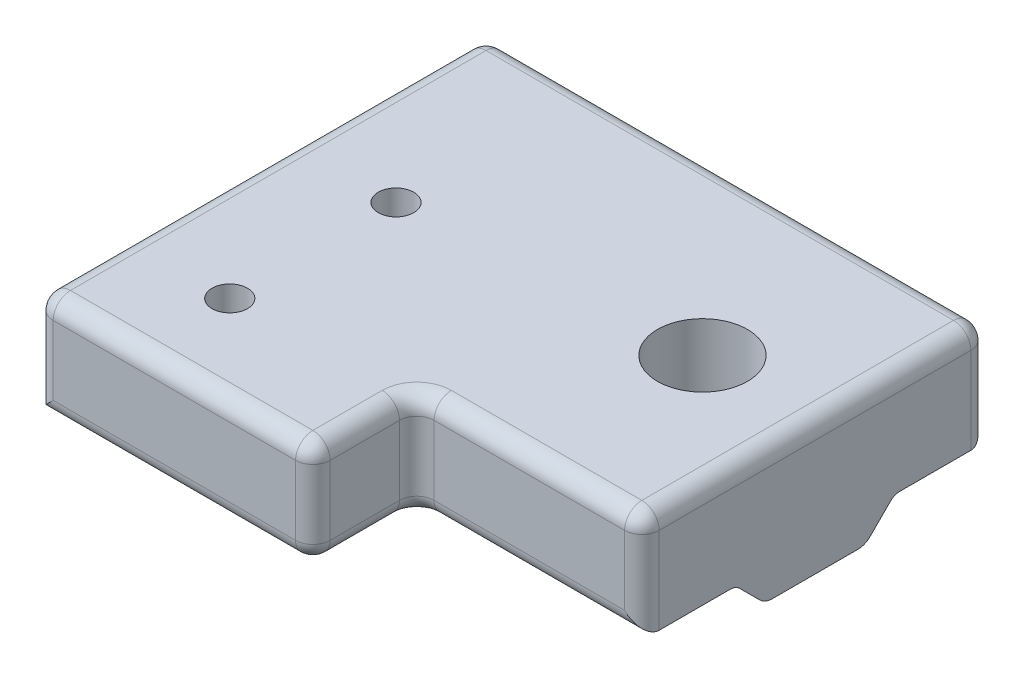
from build123d import *

# Parameters (mm, degrees)
SKETCH1_W           = 20
SKETCH1_H           = 6
BOSS_EXTRUDE1_DEPTH = 13
CUT_EXTRUDE1_REACH  = 51.362
SKETCH2_R           = 2.6
BOSS_EXTRUDE3_START = 16
BOSS_EXTRUDE3_DEPTH = 16
SKETCH6_W           = 16
SKETCH6_H           = 6
BOSS_EXTRUDE4_DEPTH = 6
SKETCH7_R           = 1.025
CUT_EXTRUDE3_DEPTH  = 6
FILLET3_R           = 1


with BuildPart() as part:
    # Sketch1 → Boss-Extrude1 (new body)
    with BuildSketch(Plane(origin=(32.364284334, 0, 0), x_dir=(0, 0, -1), z_dir=(1, 0, 0))):
        with Locations((-7.875866483, 38.765059464)):
            Rectangle(SKETCH1_W, SKETCH1_H)
        with BuildLine():
            Line((-12.22448084, 35.533673821), (-10.765866483, 34.075059464))
            Line((-10.765866483, 34.075059464), (-4.985866483, 34.075059464))
            Line((-4.985866483, 34.075059464), (-3.527252126, 35.533673821))
            ThreePointArc((-3.527252126, 35.533673821), (-3.27095768, 35.704924294), (-2.968637768, 35.765059464))
            Line((-2.968637768, 35.765059464), (-12.783095197, 35.765059464))
            ThreePointArc((-12.783095197, 35.765059464), (-12.480775285, 35.704924294), (-12.22448084, 35.533673821))
        make_face()
    extrude(amount=BOSS_EXTRUDE1_DEPTH)

    # Sketch2 → Cut-Extrude1 (cut, up to next)
    with BuildSketch(Plane.XZ.offset(-34.075059464), mode=Mode.PRIVATE) as cut_extrude1_sk1:
        with Locations(Location((38.864284334, 7.875866483, 0), (0, 0, 270))):
            Circle(SKETCH2_R)
    cut_extrude1_tool1 = extrude(cut_extrude1_sk1.sketch, amount=-CUT_EXTRUDE1_REACH, mode=Mode.PRIVATE) & part.part
    add(cut_extrude1_tool1.solids().sort_by_distance((38.864284, 34.075059, 7.875866))[0], mode=Mode.SUBTRACT)

    # Sketch5 → Boss-Extrude3 (add)
    with BuildSketch(Plane.ZY.offset(-32.364284334).offset(BOSS_EXTRUDE3_START)):
        with BuildLine():
            Line((12.783095197, 35.765059464), (17.875866483, 35.765059464))
            Line((17.875866483, 35.765059464), (17.875866483, 41.765059464))
            Line((17.875866483, 41.765059464), (-2.124133517, 41.765059464))
            Line((-2.124133517, 41.765059464), (-2.124133517, 35.765059464))
            Line((-2.124133517, 35.765059464), (2.968637768, 35.765059464))
            ThreePointArc((2.968637768, 35.765059464), (3.27095768, 35.704924294), (3.527252126, 35.533673821))
            Line((3.527252126, 35.533673821), (4.985866483, 34.075059464))
            Line((4.985866483, 34.075059464), (10.765866483, 34.075059464))
            Line((10.765866483, 34.075059464), (12.22448084, 35.533673821))
            ThreePointArc((12.22448084, 35.533673821), (12.480775285, 35.704924294), (12.783095197, 35.765059464))
        make_face()
    extrude(amount=-BOSS_EXTRUDE3_DEPTH)

    # Sketch6 → Boss-Extrude4 (add)
    with BuildSketch(Plane.XY.offset(17.875866483)):
        with Locations((24.364284334, 38.765059464)):
            Rectangle(SKETCH6_W, SKETCH6_H)
    extrude(amount=BOSS_EXTRUDE4_DEPTH)

    # Sketch7 → Cut-Extrude3 (cut)
    with BuildSketch(Plane(origin=(0, 41.765059464, 0), x_dir=(1, 0, 0), z_dir=(0, 1, 0))):
        with Locations(Location((22.364284334, -9.075866483, 0), (0, 0, 270))):
            Circle(SKETCH7_R)
        with Locations(Location((22.364284334, -18.675866483, 0), (0, 0, 270))):
            Circle(SKETCH7_R)
    extrude(amount=-CUT_EXTRUDE3_DEPTH, mode=Mode.SUBTRACT)

    # Fillet3
    # the kernel refuses this fillet: 1 mm, written as the material it adds along each edge
    with BuildSketch(Plane(origin=(32.364284334, 41.765059464, 17.875866483), x_dir=(1, 0, 0), z_dir=(0, -1, 0))) as fillet3_piece_1:
        with BuildLine():
            CenterArc((FILLET3_R, FILLET3_R), FILLET3_R, 180, 90)
            Line((0, FILLET3_R), (0, 0))
            Line((0, 0), (FILLET3_R, 0))
        make_face()
    extrude(amount=6)
    # the kernel refuses this fillet: 1 mm, written as the material it takes off along each edge
    with BuildSketch(Plane(origin=(17.364284334, 40.765059464, 22.875866483), x_dir=(-1, 0, 0), z_dir=(0, 1, 0))) as fillet3_2_piece_1_section:
        Polygon((0, 0), (FILLET3_R, 0), (FILLET3_R, FILLET3_R), (0, FILLET3_R), align=None)
    fillet3_2_piece_1 = extrude(amount=FILLET3_R, mode=Mode.PRIVATE)
    fillet3_2_piece_1 = fillet3_2_piece_1 - Plane(origin=(17.364284334, 40.765059464, 22.875866483), x_dir=(0.7071067811865475, 0, -0.7071067811865475), z_dir=(0, 1, 0)) * Sphere(FILLET3_R, mode=Mode.PRIVATE)
    add(fillet3_2_piece_1, mode=Mode.SUBTRACT)
    with BuildSketch(Plane(origin=(17.364284334, 40.765059464, -1.124133517), x_dir=(-1, 0, 0), z_dir=(0, 1, 0))) as fillet3_2_piece_2_section:
        Polygon((0, 0), (FILLET3_R, 0), (FILLET3_R, -FILLET3_R), (0, -FILLET3_R), align=None)
    fillet3_2_piece_2 = extrude(amount=FILLET3_R, mode=Mode.PRIVATE)
    fillet3_2_piece_2 = fillet3_2_piece_2 - Plane(origin=(17.364284334, 40.765059464, -1.124133517), x_dir=(0.7071067811865475, 0, 0.7071067811865475), z_dir=(0, 1, 0)) * Sphere(FILLET3_R, mode=Mode.PRIVATE)
    add(fillet3_2_piece_2, mode=Mode.SUBTRACT)
    with BuildSketch(Plane(origin=(31.364284334, 36.765059464, 22.875866483), x_dir=(0, 0, 1), z_dir=(0, -1, 0))) as fillet3_2_piece_3_section:
        Polygon((0, 0), (FILLET3_R, 0), (FILLET3_R, -FILLET3_R), (0, -FILLET3_R), align=None)
    fillet3_2_piece_3 = extrude(amount=FILLET3_R, mode=Mode.PRIVATE)
    fillet3_2_piece_3 = fillet3_2_piece_3 - Plane(origin=(31.364284334, 36.765059464, 22.875866483), x_dir=(-0.7071067811865475, 0, -0.7071067811865475), z_dir=(0, -1, 0)) * Sphere(FILLET3_R, mode=Mode.PRIVATE)
    add(fillet3_2_piece_3, mode=Mode.SUBTRACT)
    with BuildSketch(Plane(origin=(31.364284334, 40.765059464, 22.875866483), x_dir=(0, 0, 1), z_dir=(0, 1, 0))) as fillet3_2_piece_4_section:
        Polygon((0, 0), (FILLET3_R, 0), (FILLET3_R, FILLET3_R), (0, FILLET3_R), align=None)
    fillet3_2_piece_4 = extrude(amount=FILLET3_R, mode=Mode.PRIVATE)
    fillet3_2_piece_4 = fillet3_2_piece_4 - Plane(origin=(31.364284334, 40.765059464, 22.875866483), x_dir=(-0.7071067811865475, 0, -0.7071067811865475), z_dir=(0, 1, 0)) * Sphere(FILLET3_R, mode=Mode.PRIVATE)
    add(fillet3_2_piece_4, mode=Mode.SUBTRACT)
    with BuildSketch(Plane(origin=(44.364284334, 40.765059464, 16.875866483), x_dir=(1, 0, 0), z_dir=(0, 1, 0))) as fillet3_2_piece_5_section:
        Polygon((0, 0), (FILLET3_R, 0), (FILLET3_R, -FILLET3_R), (0, -FILLET3_R), align=None)
    fillet3_2_piece_5 = extrude(amount=FILLET3_R, mode=Mode.PRIVATE)
    fillet3_2_piece_5 = fillet3_2_piece_5 - Plane(origin=(44.364284334, 40.765059464, 16.875866483), x_dir=(-0.7071067811865475, 0, -0.7071067811865475), z_dir=(0, 1, 0)) * Sphere(FILLET3_R, mode=Mode.PRIVATE)
    add(fillet3_2_piece_5, mode=Mode.SUBTRACT)
    with BuildSketch(Plane(origin=(44.364284334, 40.765059464, -1.124133517), x_dir=(0, 0, -1), z_dir=(0, 1, 0))) as fillet3_2_piece_6_section:
        Polygon((0, 0), (FILLET3_R, 0), (FILLET3_R, -FILLET3_R), (0, -FILLET3_R), align=None)
    fillet3_2_piece_6 = extrude(amount=FILLET3_R, mode=Mode.PRIVATE)
    fillet3_2_piece_6 = fillet3_2_piece_6 - Plane(origin=(44.364284334, 40.765059464, -1.124133517), x_dir=(-0.7071067811865475, 0, 0.7071067811865475), z_dir=(0, 1, 0)) * Sphere(FILLET3_R, mode=Mode.PRIVATE)
    add(fillet3_2_piece_6, mode=Mode.SUBTRACT)
    with BuildSketch(Plane(origin=(16.364284334, 41.765059464, 22.875866483), x_dir=(0, -1, 0), z_dir=(0, 0, -1))) as fillet3_2_piece_7:
        with BuildLine():
            CenterArc((FILLET3_R, -FILLET3_R), FILLET3_R, 90, 90)
            Line((0, -FILLET3_R), (0, 0))
            Line((0, 0), (FILLET3_R, 0))
        make_face()
    extrude(amount=24, mode=Mode.SUBTRACT)
    with BuildSketch(Plane(origin=(16.364284334, 40.765059464, -2.124133517), x_dir=(0, 0, 1), z_dir=(0, -1, 0)), Plane(origin=(16.364284334, 33.265059464, 23.875866483), x_dir=(0, 0, -1), z_dir=(0, 1, 0)), Plane(origin=(45.364284334, 33.265059464, -2.124133517), x_dir=(0, 0, 1), z_dir=(0, 1, 0)), Plane(origin=(45.364284334, 40.765059464, 17.875866483), x_dir=(0, 0, -1), z_dir=(0, -1, 0))) as fillet3_2_piece_8:
        with BuildLine():
            CenterArc((FILLET3_R, -FILLET3_R), FILLET3_R, 90, 90)
            Line((0, -FILLET3_R), (0, 0))
            Line((0, 0), (FILLET3_R, 0))
        make_face()
    extrude(amount=7.5, mode=Mode.SUBTRACT)
    with BuildSketch(Plane(origin=(32.364284334, 35.765059464, 18.875866483), x_dir=(-1, 0, 0), z_dir=(0, 0, 1)), Plane(origin=(32.364284334, 41.765059464, 18.875866483), x_dir=(0, -1, 0), z_dir=(0, 0, 1))) as fillet3_2_piece_9:
        with BuildLine():
            CenterArc((FILLET3_R, -FILLET3_R), FILLET3_R, 90, 90)
            Line((0, -FILLET3_R), (0, 0))
            Line((0, 0), (FILLET3_R, 0))
        make_face()
    extrude(amount=4, mode=Mode.SUBTRACT)
    with BuildSketch(Plane(origin=(31.364284334, 35.765059464, 23.875866483), x_dir=(0, 0, -1), z_dir=(-1, 0, 0))) as fillet3_2_piece_10:
        with BuildLine():
            CenterArc((FILLET3_R, -FILLET3_R), FILLET3_R, 90, 90)
            Line((0, -FILLET3_R), (0, 0))
            Line((0, 0), (FILLET3_R, 0))
        make_face()
    extrude(amount=17.5, mode=Mode.SUBTRACT)
    with BuildSketch(Plane(origin=(32.364284334, 40.765059464, 23.875866483), x_dir=(-1, 0, 0), z_dir=(0, -1, 0))) as fillet3_2_piece_11:
        with BuildLine():
            CenterArc((FILLET3_R, FILLET3_R), FILLET3_R, 180, 90)
            Line((0, FILLET3_R), (0, 0))
            Line((0, 0), (FILLET3_R, 0))
        make_face()
    extrude(amount=4, mode=Mode.SUBTRACT)
    with BuildSketch(Plane(origin=(17.364284334, 41.765059464, 23.875866483), x_dir=(0, -1, 0), z_dir=(1, 0, 0))) as fillet3_2_piece_12:
        with BuildLine():
            CenterArc((FILLET3_R, FILLET3_R), FILLET3_R, 180, 90)
            Line((0, FILLET3_R), (0, 0))
            Line((0, 0), (FILLET3_R, 0))
        make_face()
    extrude(amount=14, mode=Mode.SUBTRACT)
    with BuildSketch(Plane(origin=(47.864284334, 35.765059464, 17.875866483), x_dir=(0, 0, -1), z_dir=(-1, 0, 0))) as fillet3_2_piece_13:
        with BuildLine():
            CenterArc((FILLET3_R, -FILLET3_R), FILLET3_R, 90, 90)
            Line((0, -FILLET3_R), (0, 0))
            Line((0, 0), (FILLET3_R, 0))
        make_face()
    extrude(amount=14.5, mode=Mode.SUBTRACT)
    with BuildSketch(Plane(origin=(44.364284334, 41.765059464, 17.875866483), x_dir=(0, -1, 0), z_dir=(-1, 0, 0))) as fillet3_2_piece_14:
        with BuildLine():
            CenterArc((FILLET3_R, -FILLET3_R), FILLET3_R, 90, 90)
            Line((0, -FILLET3_R), (0, 0))
            Line((0, 0), (FILLET3_R, 0))
        make_face()
    extrude(amount=11, mode=Mode.SUBTRACT)
    with BuildSketch(Plane(origin=(17.364284334, 41.765059464, -2.124133517), x_dir=(0, 0, 1), z_dir=(1, 0, 0))) as fillet3_2_piece_15:
        with BuildLine():
            CenterArc((FILLET3_R, FILLET3_R), FILLET3_R, 180, 90)
            Line((0, FILLET3_R), (0, 0))
            Line((0, 0), (FILLET3_R, 0))
        make_face()
    extrude(amount=27, mode=Mode.SUBTRACT)
    with BuildSketch(Plane(origin=(13.864284334, 35.765059464, -2.124133517), x_dir=(0, 1, 0), z_dir=(1, 0, 0))) as fillet3_2_piece_16:
        with BuildLine():
            CenterArc((FILLET3_R, FILLET3_R), FILLET3_R, 180, 90)
            Line((0, FILLET3_R), (0, 0))
            Line((0, 0), (FILLET3_R, 0))
        make_face()
    extrude(amount=34, mode=Mode.SUBTRACT)
    with BuildSketch(Plane(origin=(15.328750428, 34.075059464, 4.985866483), x_dir=(0, 0.7071067811865497, -0.7071067811865454), z_dir=(1, 0, 0))) as fillet3_2_piece_17:
        with BuildLine():
            CenterArc((FILLET3_R * 0.414213562373, FILLET3_R), FILLET3_R, 225, 45)
            Line((-FILLET3_R * 0.292893218813, FILLET3_R * 0.292893218813), (0, 0))
            Line((0, 0), (FILLET3_R * 0.414213562373, 0))
        make_face()
    extrude(amount=31.071067812, mode=Mode.SUBTRACT)
    with BuildSketch(Plane(origin=(15.328750428, 34.075059464, 10.765866483), x_dir=(0, 0.7071067811865432, 0.7071067811865518), z_dir=(1, 0, 0))) as fillet3_2_piece_18:
        with BuildLine():
            CenterArc((FILLET3_R * 0.414213562373, -FILLET3_R), FILLET3_R, 90, 45)
            Line((-FILLET3_R * 0.292893218813, -FILLET3_R * 0.292893218813), (0, 0))
            Line((0, 0), (FILLET3_R * 0.414213562373, 0))
        make_face()
    extrude(amount=31.071067812, mode=Mode.SUBTRACT)
    with BuildSketch(Plane(origin=(45.364284334, 41.765059464, -1.124133517), x_dir=(0, -1, 0), z_dir=(0, 0, 1))) as fillet3_2_piece_19:
        with BuildLine():
            CenterArc((FILLET3_R, -FILLET3_R), FILLET3_R, 90, 90)
            Line((0, -FILLET3_R), (0, 0))
            Line((0, 0), (FILLET3_R, 0))
        make_face()
    extrude(amount=18, mode=Mode.SUBTRACT)
    with BuildSketch(Plane(origin=(33.364284334, 41.765059464, 18.875866483), x_dir=(0, 0, -1), z_dir=(1, 0, 0))) as fillet3_2_piece_20:
        with BuildLine():
            CenterArc((1 + FILLET3_R, -FILLET3_R), FILLET3_R, 90, 90)
            Line((1, -FILLET3_R), (1, 0))
            Line((1, 0), (1 + FILLET3_R, 0))
        make_face()
    revolve(axis=Axis((33.364284334, 41.765059464, 18.875866483), (0, 1, 0)), revolution_arc=90, mode=Mode.SUBTRACT)
    with BuildSketch(Plane(origin=(33.364284334, 35.765059464, 18.875866483), x_dir=(0, 0, -1), z_dir=(1, 0, 0))) as fillet3_2_piece_21:
        with BuildLine():
            CenterArc((1 + FILLET3_R, FILLET3_R), FILLET3_R, 180, 90)
            Line((1, FILLET3_R), (1, 0))
            Line((1, 0), (1 + FILLET3_R, 0))
        make_face()
    revolve(axis=Axis((33.364284334, 35.765059464, 18.875866483), (0, 1, 0)), revolution_arc=90, mode=Mode.SUBTRACT)


solid = part.part
